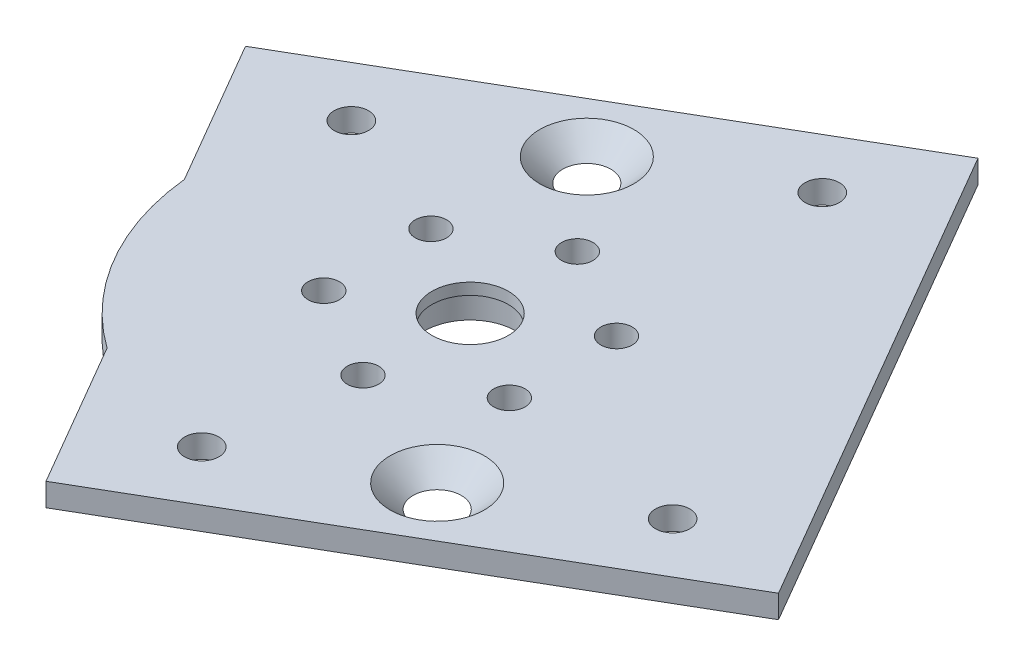
from build123d import *

# Parameters (mm, degrees)
SKETCH_1_R          = 34
SKETCH_1_R_2        = 2.05
SKETCH_1_R_3        = 6
EXTRUDE_1_DEPTH     = 3
SKETCH_5_R          = 6.5
SKETCH_5_R_2        = 5
EXTRUDE_4_DEPTH     = 1.5
EXTRUDE_START       = 2
SKETCH_6_R          = 7
SKETCH_6_R_2        = 6
EXTRUDE_5_DEPTH     = 2
EXTRUDE_START_2     = -3
EXTRUDE_6_DEPTH     = 3
SKETCH_9_R          = 2.25
SKETCH_9_R_2        = 3.05
CUT_EXTRUDE_1_DEPTH = 3
CHAMFER_2_SIZE      = 3.1


with BuildPart() as part:
    # 草图1 → 凸台-拉伸1 (new body)
    with BuildSketch(Plane(origin=(0, 0, 0), x_dir=(1, 0, 0), z_dir=(0, 1, 0))):
        with Locations(Location((0, 0, 0), (0, 0, 270))):
            Circle(SKETCH_1_R)
        with Locations(Location((0, 14, 0), (0, 0, 270))):
            Circle(SKETCH_1_R_2, mode=Mode.SUBTRACT)
        with Locations(Location((12.124355653, 7, 0), (0, 0, 270))):
            Circle(SKETCH_1_R_2, mode=Mode.SUBTRACT)
        with Locations(Location((12.124355653, -7, 0), (0, 0, 270))):
            Circle(SKETCH_1_R_2, mode=Mode.SUBTRACT)
        with Locations(Location((0, -14, 0), (0, 0, 270))):
            Circle(SKETCH_1_R_2, mode=Mode.SUBTRACT)
        with Locations(Location((-12.124355653, -7, 0), (0, 0, 270))):
            Circle(SKETCH_1_R_2, mode=Mode.SUBTRACT)
        with Locations(Location((-12.124355653, 7, 0), (0, 0, 270))):
            Circle(SKETCH_1_R_2, mode=Mode.SUBTRACT)
        with Locations(Location((0, 0, 0), (0, 0, 270))):
            Circle(SKETCH_1_R_3, mode=Mode.SUBTRACT)
    extrude(amount=EXTRUDE_1_DEPTH)

    # 草图5 → 凸台-拉伸4 (add)
    with BuildSketch(Plane(origin=(0, 3, 0), x_dir=(1, 0, 0), z_dir=(0, 1, 0))):
        Circle(SKETCH_5_R)
        with Locations(Location((0, 0, 0), (0, 0, 270))):
            Circle(SKETCH_5_R_2, mode=Mode.SUBTRACT)
    extrude(amount=-EXTRUDE_4_DEPTH)

    # 草图6 → 凸台-拉伸5 (add)
    with BuildSketch(Plane(origin=(0, 0, 0), x_dir=(-1, 0, 0), z_dir=(0, -1, 0)).offset(EXTRUDE_START)):
        with Locations(Location((0, 0, 0), (0, 0, 270))):
            Circle(SKETCH_6_R)
        with Locations(Location((0, 0, 0), (0, 0, 90))):
            Circle(SKETCH_6_R_2, mode=Mode.SUBTRACT)
    extrude(amount=-EXTRUDE_5_DEPTH)

    # 草图8 → 凸台-拉伸6 (add)
    with BuildSketch(Plane(origin=(0, 3, 0), x_dir=(1, 0, 0), z_dir=(0, 1, 0)).offset(EXTRUDE_START_2)):
        with BuildLine():
            Line((-8.707638575, -46.70307303), (51.809561134, -11.522559398))
            Line((51.809561134, -11.522559398), (15.62388997, 50.723703159))
            Line((15.62388997, 50.723703159), (-44.893309739, 15.543189527))
            Line((-44.893309739, 15.543189527), (-33.818604688, -3.507417415))
            ThreePointArc((-33.818604688, -3.507417415), (-1.756052475, 33.954620889), (34, 0))
            ThreePointArc((34, 0), (15.546708924, -30.237391449), (-19.782343625, -27.652466087))
            Line((-19.782343625, -27.652466087), (-8.707638575, -46.70307303))
        make_face()
    extrude(amount=EXTRUDE_6_DEPTH)

    # 草图9 → 切除-拉伸1 (cut)
    with BuildSketch(Plane(origin=(0, 0, 0), x_dir=(-1, 0, 0), z_dir=(0, -1, 0))):
        with Locations(Location((-9.34045606, 36.660685763, 0), (0, 0, 90))):
            Circle(SKETCH_9_R)
        with Locations(Location((-36.479709434, -10.024011156, 0), (0, 0, 90))):
            Circle(SKETCH_9_R)
        with Locations(Location((29.563458038, 14.044641285, 0), (0, 0, 90))):
            Circle(SKETCH_9_R)
        with Locations(Location((2.424204665, -32.640055633, 0), (0, 0, 90))):
            Circle(SKETCH_9_R)
        with Locations(Location((10.111500989, 25.352663524, 0), (0, 0, 90))):
            Circle(SKETCH_9_R_2)
        with Locations(Location((-17.027752384, -21.332033394, 0), (0, 0, 90))):
            Circle(SKETCH_9_R_2)
    extrude(amount=-CUT_EXTRUDE_1_DEPTH, mode=Mode.SUBTRACT)

    # 倒角2
    # the kernel refuses this chamfer: 3.1 mm, written as the material it takes off along each edge
    with BuildSketch(Plane(origin=(17.027752384, 3, 21.332033394), x_dir=(0, 0, -1), z_dir=(-1, 0, 0))) as chamfer_2_piece_1:
        Polygon((3.05 + CHAMFER_2_SIZE, 0), (3.05, CHAMFER_2_SIZE), (3.05, 0), align=None)
    revolve(axis=Axis((17.027752384, 3, 21.332033394), (0, -1, 0)), mode=Mode.SUBTRACT)
    with BuildSketch(Plane(origin=(-10.111500989, 3, -25.352663524), x_dir=(0, 0, -1), z_dir=(-1, 0, 0))) as chamfer_2_piece_2:
        Polygon((3.05 + CHAMFER_2_SIZE, 0), (3.05, CHAMFER_2_SIZE), (3.05, 0), align=None)
    revolve(axis=Axis((-10.111500989, 3, -25.352663524), (0, -1, 0)), mode=Mode.SUBTRACT)


solid = part.part
